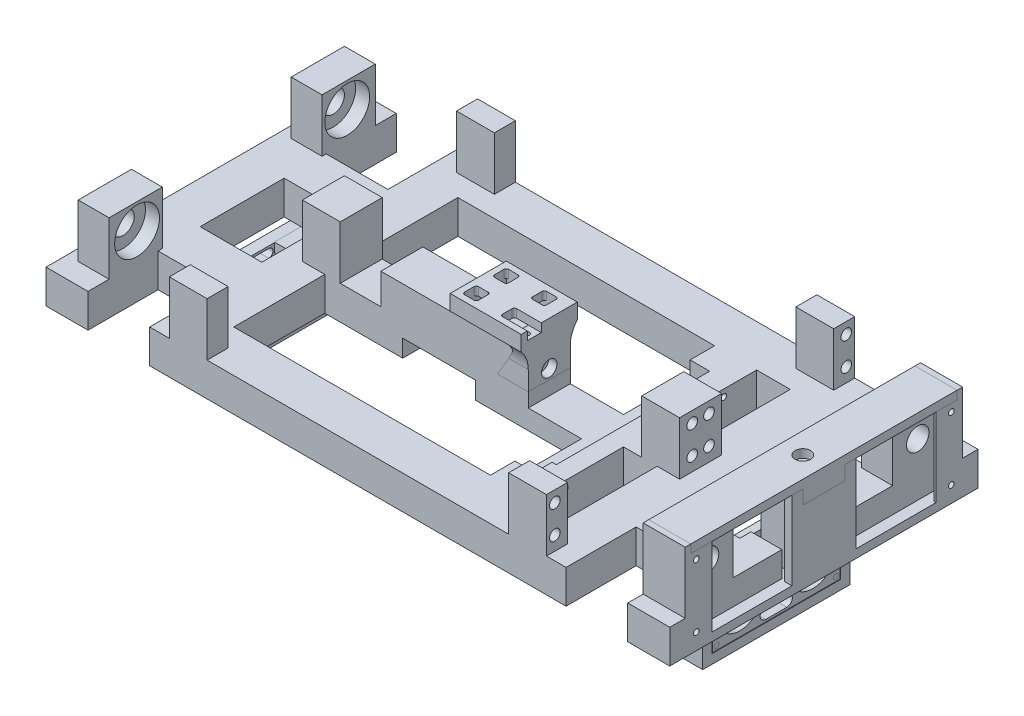
from build123d import *

# Parameters (mm, degrees)
SKETCH1_W               = 118.6
SKETCH1_H               = 32.5
BOSS_EXTRUDE1_DEPTH     = 12
SKETCH2_W               = 12
SKETCH2_H               = 7.5
BOSS_EXTRUDE2_DEPTH     = 19
SKETCH3_R               = 1.9
CUT_EXTRUDE1_DEPTH      = 190.430620545
SKETCH4_W               = 19
SKETCH4_H               = 19
SKETCH4_R               = 8
BOSS_EXTRUDE3_DEPTH     = 5
BOSS_EXTRUDE3_2_DEPTH   = 5
SKETCH6_W               = 19
SKETCH6_H               = 19
SKETCH6_R               = 4
BOSS_EXTRUDE4_DEPTH     = 6
SKETCH7_W               = 22
SKETCH7_H               = 15
BOSS_EXTRUDE5_DEPTH     = 12
SKETCH8_W               = 22
SKETCH8_H               = 30
CUT_EXTRUDE2_DEPTH      = 126.593351735
SKETCH9_W               = 40
SKETCH9_H               = 28
CUT_EXTRUDE3_DEPTH      = 4
CUT_EXTRUDE5_REACH      = 229.535
SKETCH11_W              = 3.5
SKETCH11_H              = 9
BOSS_EXTRUDE6_REACH     = 129.266
CUT_EXTRUDE7_DEPTH      = 228.534524853
CUT_EXTRUDE7_DEPTH_BACK = 3
SKETCH10_R              = 1
SKETCH13_W              = 15
SKETCH13_H              = 15
BOSS_EXTRUDE7_DEPTH     = 14
SKETCH14_W              = 15
SKETCH14_H              = 32.5
BOSS_EXTRUDE8_DEPTH     = 12
SKETCH16_W              = 15
SKETCH16_H              = 32.5
CUT_EXTRUDE8_DEPTH      = 126.593351735
SKETCH17_W              = 15
SKETCH17_H              = 32.5
BOSS_EXTRUDE9_DEPTH     = 12
SKETCH15_W              = 26
SKETCH15_H              = 62.5
CUT_EXTRUDE9_DEPTH      = 5
CUT_EXTRUDE10_REACH     = 165.298
SKETCH18_R              = 1
SKETCH19_W              = 50
SKETCH19_H              = 7
CUT_EXTRUDE11_DEPTH     = 1.5
BOSS_EXTRUDE10_DEPTH    = 15
BOSS_EXTRUDE11_DEPTH    = 15
BOSS_EXTRUDE12_DEPTH    = 4.6
BOSS_EXTRUDE13_DEPTH    = 18.6
SKETCH29_W              = 20
SKETCH29_H              = 5.5
BOSS_EXTRUDE14_DEPTH    = 2.15
SKETCH31_W              = 4.6
SKETCH31_H              = 5
SKETCH31_W_2            = 0.8
CUT_EXTRUDE12_DEPTH     = 128.266217041
FILLET1_R               = 10
SKETCH32_R              = 2.75
CUT_EXTRUDE13_DEPTH     = 3
SKETCH33_R              = 1.425
CUT_EXTRUDE14_DEPTH     = 20
SKETCH34_R              = 1
CUT_EXTRUDE15_DEPTH     = 128.266217041
BOSS_EXTRUDE15_DEPTH    = 5
BOSS_EXTRUDE16_DEPTH    = 3
SKETCH37_R              = 2.75
CUT_EXTRUDE16_DEPTH     = 3
SKETCH38_R              = 1.4
CUT_EXTRUDE17_DEPTH     = 20
SKETCH39_R              = 1.5
CUT_EXTRUDE18_DEPTH     = 3.5
SKETCH39_2_R            = 1.5
BOSS_EXTRUDE17_DEPTH    = 3.5
SKETCH41_W              = 3
SKETCH41_H              = 3.5
SKETCH41_H_2            = 7.75
SKETCH41_H_3            = 30
BOSS_EXTRUDE18_DEPTH    = 24
BOSS_EXTRUDE19_DEPTH    = 9
SKETCH43_R              = 0.9
CUT_EXTRUDE19_DEPTH     = 2
SKETCH44_W              = 7.5
SKETCH44_H              = 5
BOSS_EXTRUDE20_DEPTH    = 7.5
SKETCH45_R              = 2.75
CUT_EXTRUDE20_DEPTH     = 3
SKETCH47_R              = 1.4
CUT_EXTRUDE22_DEPTH     = 10
BOSS_EXTRUDE22_START    = 5
SKETCH48_W              = 45.5
SKETCH48_H              = 20.3
SKETCH48_R              = 8.1
SKETCH48_R_2            = 0.9
BOSS_EXTRUDE22_DEPTH    = 4
SKETCH49_R              = 0.9
BOSS_EXTRUDE23_DEPTH    = 11
BOSS_EXTRUDE23_2_DEPTH  = 11
BOSS_EXTRUDE23_3_DEPTH  = 11
BOSS_EXTRUDE23_4_DEPTH  = 11
SKETCH42_3_W            = 14.45
SKETCH42_3_H            = 3.3
BOSS_EXTRUDE24_DEPTH    = 5
SKETCH50_W              = 26
SKETCH50_H              = 2.2
SKETCH50_H_2            = 12.8
CUT_EXTRUDE23_DEPTH     = 5
SKETCH50_4_W            = 26
SKETCH50_4_H            = 2.2
CUT_EXTRUDE25_DEPTH     = 6.2
SKETCH52_W              = 14.45
SKETCH52_H              = 3.3
BOSS_EXTRUDE25_DEPTH    = 5
SKETCH53_R              = 1.4
CUT_EXTRUDE26_DEPTH     = 8.6
SKETCH54_W              = 15
SKETCH54_H              = 2
BOSS_EXTRUDE26_DEPTH    = 22
SKETCH55_W              = 1.5
SKETCH55_H              = 7.5
SKETCH55_H_2            = 15
BOSS_EXTRUDE27_DEPTH    = 19


with BuildPart() as part:
    # Sketch1 → Boss-Extrude1 (new body)
    with BuildSketch(Plane(origin=(0, 0, 0), x_dir=(1, 0, 0), z_dir=(0, 1, 0))):
        Polygon((-96.3, -55), (-96.3, -7.5), (-74.3, -7.5), (-74.3, -55), (74.3, -55), (74.3, -7.5), (96.3, -7.5), (96.3, -55), (111.3, -55), (111.3, 55), (96.3, 55), (96.3, 7.5), (74.3, 7.5), (74.3, 55), (-74.3, 55), (-74.3, 7.5), (-96.3, 7.5), (-96.3, 55), (-111.3, 55), (-111.3, -55), align=None)
        with Locations((0, -23.75)):
            Rectangle(SKETCH1_W, SKETCH1_H, mode=Mode.SUBTRACT)
        with Locations((0, 23.75)):
            Rectangle(SKETCH1_W, SKETCH1_H, mode=Mode.SUBTRACT)
    extrude(amount=BOSS_EXTRUDE1_DEPTH)

    # Sketch2 → Boss-Extrude2 (add)
    with BuildSketch(Plane(origin=(0, 12, 0), x_dir=(1, 0, 0), z_dir=(0, 1, 0))):
        with Locations((-61.3, 51.25)):
            Rectangle(SKETCH2_W, SKETCH2_H)
        Polygon((-67.3, 7.5), (-55.3, 7.5), (-55.3, 0), (-55.3, -7.5), (-67.3, -7.5), (-67.3, 0), align=None)
        with Locations((-61.3, -51.25)):
            Rectangle(SKETCH2_W, SKETCH2_H)
        with Locations((61.3, -51.25)):
            Rectangle(SKETCH2_W, SKETCH2_H)
        Polygon((67.3, 7.5), (67.3, 0), (67.3, -7.5), (55.3, -7.5), (55.3, 0), (55.3, 7.5), align=None)
        with Locations((61.3, 51.25)):
            Rectangle(SKETCH2_W, SKETCH2_H)
    extrude(amount=BOSS_EXTRUDE2_DEPTH)

    # Sketch3 → Cut-Extrude1 (cut, through all)
    with BuildSketch(Plane.ZY.offset(67.3)):
        with Locations((-52, 17)):
            Circle(SKETCH3_R)
        with Locations((-52, 27)):
            Circle(SKETCH3_R)
        with Locations((-3, 17)):
            Circle(SKETCH3_R)
        with Locations((-3, 27)):
            Circle(SKETCH3_R)
        with Locations((3, 27)):
            Circle(SKETCH3_R)
        with Locations((3, 17)):
            Circle(SKETCH3_R)
        with Locations((52, 17)):
            Circle(SKETCH3_R)
        with Locations((52, 27)):
            Circle(SKETCH3_R)
    extrude(amount=-CUT_EXTRUDE1_DEPTH, mode=Mode.SUBTRACT)



with BuildPart() as body_2:
    # Sketch4 → Boss-Extrude3 (new body)
    with BuildSketch(Plane.ZY.offset(-96.3)):
        with Locations((-38, 21.5)):
            Rectangle(SKETCH4_W, SKETCH4_H)
        with Locations(Location((-37.5, 22, 0), (0, 0, 180))):
            Circle(SKETCH4_R, mode=Mode.SUBTRACT)
    extrude(amount=-BOSS_EXTRUDE3_DEPTH)


with BuildPart() as body_3:
    # Sketch4 → Boss-Extrude3 2 (new body)
    with BuildSketch(Plane.ZY.offset(-96.3)):
        with Locations((38, 21.5)):
            Rectangle(SKETCH4_W, SKETCH4_H)
        with Locations((37.5, 22)):
            Circle(SKETCH4_R, mode=Mode.SUBTRACT)
    extrude(amount=-BOSS_EXTRUDE3_2_DEPTH)


    add(body_2.part)  # Boss-Extrude4 merges body 2
    # Sketch6 → Boss-Extrude4 (add)
    # profile 1 of 2: a face of its own
    with BuildSketch(Plane(origin=(101.3, 0, 0), x_dir=(0, 0, -1), z_dir=(1, 0, 0))):
        with Locations((-38, 21.5)):
            Rectangle(SKETCH6_W, SKETCH6_H)
        with Locations((-37.5, 22)):
            Circle(SKETCH6_R, mode=Mode.SUBTRACT)
    # profile 2 of 2: a face of its own
    with BuildSketch(Plane(origin=(101.3, 0, 0), x_dir=(0, 0, -1), z_dir=(1, 0, 0))):
        with Locations((38, 21.5)):
            Rectangle(SKETCH6_W, SKETCH6_H)
        with Locations((37.5, 22)):
            Circle(SKETCH6_R, mode=Mode.SUBTRACT)
    extrude(amount=BOSS_EXTRUDE4_DEPTH)


with BuildPart() as body_3_2:
    # Mirror1: mirrored copy
    add(body_3.part.mirror(Plane(origin=(0, 0, 0), x_dir=(0, 0, 1), z_dir=(1, 0, 0))))


with BuildPart() as part_1:
    add(part.part)

    add(body_3.part)  # Boss-Extrude5 merges body 3

    add(body_3_2.part)  # Boss-Extrude5 merges body 3 2
    # Sketch7 → Boss-Extrude5 (add)
    with BuildSketch(Plane(origin=(0, 0, 0), x_dir=(1, 0, 0), z_dir=(0, 1, 0))):
        with Locations((-85.3, 22.5)):
            Rectangle(SKETCH7_W, SKETCH7_H)
        with Locations((85.3, 22.5)):
            Rectangle(SKETCH7_W, SKETCH7_H)
        with Locations((85.3, -22.5)):
            Rectangle(SKETCH7_W, SKETCH7_H)
        with Locations((-85.3, -22.5)):
            Rectangle(SKETCH7_W, SKETCH7_H)
    extrude(amount=BOSS_EXTRUDE5_DEPTH)

    # Sketch8 → Cut-Extrude2 (cut, through all)
    with BuildSketch(Plane(origin=(0, 12, 0), x_dir=(1, 0, 0), z_dir=(0, 1, 0))):
        with Locations((-85.3, 0)):
            Rectangle(SKETCH8_W, SKETCH8_H)
        with Locations((85.3, 0)):
            Rectangle(SKETCH8_W, SKETCH8_H)
    extrude(amount=-CUT_EXTRUDE2_DEPTH, mode=Mode.SUBTRACT)

    # Sketch9 → Cut-Extrude3 (cut)
    with BuildSketch(Plane(origin=(111.3, 0, 0), x_dir=(0, 0, -1), z_dir=(1, 0, 0))):
        with Locations((-27.5, 17)):
            Rectangle(SKETCH9_W, SKETCH9_H)
        with Locations((27.5, 17)):
            Rectangle(SKETCH9_W, SKETCH9_H)
    extrude(amount=-CUT_EXTRUDE3_DEPTH, mode=Mode.SUBTRACT)

    # Sketch11 → Cut-Extrude5 (cut, up to next)
    with BuildSketch(Plane(origin=(107.3, 0, 0), x_dir=(0, 0, -1), z_dir=(1, 0, 0)), mode=Mode.PRIVATE) as cut_extrude5_sk1:
        with Locations((-9.25, 7.5)):
            Rectangle(SKETCH11_W, SKETCH11_H)
    cut_extrude5_tool1 = extrude(cut_extrude5_sk1.sketch, amount=-CUT_EXTRUDE5_REACH, mode=Mode.PRIVATE) & part_1.part
    # Sketch11 → Cut-Extrude5 (cut, up to next)
    with BuildSketch(Plane(origin=(107.3, 0, 0), x_dir=(0, 0, -1), z_dir=(1, 0, 0)), mode=Mode.PRIVATE) as cut_extrude5_sk2:
        with Locations((9.25, 7.5)):
            Rectangle(SKETCH11_W, SKETCH11_H)
    cut_extrude5_tool2 = extrude(cut_extrude5_sk2.sketch, amount=-CUT_EXTRUDE5_REACH, mode=Mode.PRIVATE) & part_1.part
    add(cut_extrude5_tool1.solids().sort_by_distance((107.3, 7.5, 9.25))[0], mode=Mode.SUBTRACT)
    add(cut_extrude5_tool2.solids().sort_by_distance((107.3, 7.5, -9.25))[0], mode=Mode.SUBTRACT)

    # Boss-Extrude6: up to this face of the body (flat: up to its plane)
    boss_extrude6_end = Plane(part_1.part.faces().sort_by_distance((101.8, 31, 38))[0])
    # Sketch12 → Boss-Extrude6 (add, up to the picked face)
    with BuildSketch(Plane(origin=(0, 3, 0), x_dir=(1, 0, 0), z_dir=(0, 1, 0)), mode=Mode.PRIVATE) as boss_extrude6_sk1:
        Polygon((108.6, -11.4), (111.3, -11.4), (111.3, -7.5), (110.6, -7.5), (110.6, -10.4), (108.6, -10.4), align=None)
    boss_extrude6_tool1 = split(extrude(boss_extrude6_sk1.sketch, amount=BOSS_EXTRUDE6_REACH, mode=Mode.PRIVATE), bisect_by=boss_extrude6_end, keep=Keep.BOTH, mode=Mode.PRIVATE)
    # Sketch12 → Boss-Extrude6 (add, up to the picked face)
    with BuildSketch(Plane(origin=(0, 3, 0), x_dir=(1, 0, 0), z_dir=(0, 1, 0)), mode=Mode.PRIVATE) as boss_extrude6_sk2:
        Polygon((111.3, -47.5), (108.6, -47.5), (108.6, -42.5), (110.6, -42.5), (110.6, -40), (111.3, -40), (111.3, -42.5), align=None)
    boss_extrude6_tool2 = split(extrude(boss_extrude6_sk2.sketch, amount=BOSS_EXTRUDE6_REACH, mode=Mode.PRIVATE), bisect_by=boss_extrude6_end, keep=Keep.BOTH, mode=Mode.PRIVATE)
    # Sketch12 → Boss-Extrude6 (add, up to the picked face)
    with BuildSketch(Plane(origin=(0, 3, 0), x_dir=(1, 0, 0), z_dir=(0, 1, 0)), mode=Mode.PRIVATE) as boss_extrude6_sk3:
        Polygon((111.3, 47.5), (108.6, 47.5), (108.6, 42.5), (110.6, 42.5), (110.6, 40), (111.3, 40), (111.3, 42.5), align=None)
    boss_extrude6_tool3 = split(extrude(boss_extrude6_sk3.sketch, amount=BOSS_EXTRUDE6_REACH, mode=Mode.PRIVATE), bisect_by=boss_extrude6_end, keep=Keep.BOTH, mode=Mode.PRIVATE)
    # Sketch12 → Boss-Extrude6 (add, up to the picked face)
    with BuildSketch(Plane(origin=(0, 3, 0), x_dir=(1, 0, 0), z_dir=(0, 1, 0)), mode=Mode.PRIVATE) as boss_extrude6_sk4:
        Polygon((108.6, 11.4), (108.6, 10.4), (110.6, 10.4), (110.6, 7.5), (111.3, 7.5), (111.3, 11.4), align=None)
    boss_extrude6_tool4 = split(extrude(boss_extrude6_sk4.sketch, amount=BOSS_EXTRUDE6_REACH, mode=Mode.PRIVATE), bisect_by=boss_extrude6_end, keep=Keep.BOTH, mode=Mode.PRIVATE)
    add(boss_extrude6_tool1.solids().sort_by(Axis((109.95, 3, 11.352566), (0, 1, 0)))[0])
    add(boss_extrude6_tool2.solids().sort_by(Axis((110.064754, 3, 44.569672), (0, 1, 0)))[0])
    add(boss_extrude6_tool3.solids().sort_by(Axis((110.064754, 3, -44.569672), (0, 1, 0)))[0])
    add(boss_extrude6_tool4.solids().sort_by(Axis((108.647434, 3, -10.9), (0, 1, 0)))[0])

    # Sketch10 → Cut-Extrude7 (cut, two sides: drawn at the far end of the back side and taken through both)
    with BuildSketch(Plane(origin=(107.3, 0, 0), x_dir=(0, 0, -1), z_dir=(1, 0, 0)).offset(-CUT_EXTRUDE7_DEPTH_BACK)):
        with Locations((-45.5, 28.25)):
            Circle(SKETCH10_R)
        with Locations((-45.5, 5.75)):
            Circle(SKETCH10_R)
        with Locations(Location((45.5, 5.75, 0), (0, 0, 180))):
            Circle(SKETCH10_R)
        with Locations(Location((45.5, 28.25, 0), (0, 0, 180))):
            Circle(SKETCH10_R)
    extrude(amount=CUT_EXTRUDE7_DEPTH + CUT_EXTRUDE7_DEPTH_BACK, mode=Mode.SUBTRACT)

    # Sketch13 → Boss-Extrude7 (add)
    with BuildSketch(Plane(origin=(0, 12, 0), x_dir=(1, 0, 0), z_dir=(0, 1, 0))):
        with Locations((103.8, 0)):
            Rectangle(SKETCH13_W, SKETCH13_H)
    extrude(amount=BOSS_EXTRUDE7_DEPTH)

    # Sketch14 → Boss-Extrude8 (add)
    with BuildSketch(Plane(origin=(0, 0, 0), x_dir=(1, 0, 0), z_dir=(0, 1, 0))):
        with Locations((0, -23.75)):
            Rectangle(SKETCH14_W, SKETCH14_H)
        with Locations((0, 23.75)):
            Rectangle(SKETCH14_W, SKETCH14_H)
    extrude(amount=BOSS_EXTRUDE8_DEPTH)

    # Sketch16 → Cut-Extrude8 (cut, through all)
    with BuildSketch(Plane(origin=(0, 12, 0), x_dir=(1, 0, 0), z_dir=(0, 1, 0))):
        with Locations((0, 23.75)):
            Rectangle(SKETCH16_W, SKETCH16_H)
        with Locations((0, -23.75)):
            Rectangle(SKETCH16_W, SKETCH16_H)
    extrude(amount=-CUT_EXTRUDE8_DEPTH, mode=Mode.SUBTRACT)

    # Sketch17 → Boss-Extrude9 (add)
    with BuildSketch(Plane(origin=(0, 0, 0), x_dir=(1, 0, 0), z_dir=(0, 1, 0))):
        with Locations((39.800000001, 23.75)):
            Rectangle(SKETCH17_W, SKETCH17_H)
        with Locations((39.800000001, -23.75)):
            Rectangle(SKETCH17_W, SKETCH17_H)
    extrude(amount=BOSS_EXTRUDE9_DEPTH)

    # Sketch15 → Cut-Extrude9 (cut)
    with BuildSketch(Plane(origin=(0, 12, 0), x_dir=(1, 0, 0), z_dir=(0, 1, 0))):
        with Locations((26.3, 0)):
            Rectangle(SKETCH15_W, SKETCH15_H)
    extrude(amount=-CUT_EXTRUDE9_DEPTH, mode=Mode.SUBTRACT)

    # Sketch18 → Cut-Extrude10 (cut, up to next)
    with BuildSketch(Plane.ZY.offset(-39.3), mode=Mode.PRIVATE) as cut_extrude10_sk1:
        with Locations((28.25, 9.5)):
            Circle(SKETCH18_R)
    cut_extrude10_tool1 = extrude(cut_extrude10_sk1.sketch, amount=-CUT_EXTRUDE10_REACH, mode=Mode.PRIVATE) & part_1.part
    # Sketch18 → Cut-Extrude10 (cut, up to next)
    with BuildSketch(Plane.ZY.offset(-39.3), mode=Mode.PRIVATE) as cut_extrude10_sk2:
        with Locations((-28.25, 9.5)):
            Circle(SKETCH18_R)
    cut_extrude10_tool2 = extrude(cut_extrude10_sk2.sketch, amount=-CUT_EXTRUDE10_REACH, mode=Mode.PRIVATE) & part_1.part
    add(cut_extrude10_tool1.solids().sort_by_distance((39.3, 9.5, 28.25))[0], mode=Mode.SUBTRACT)
    add(cut_extrude10_tool2.solids().sort_by_distance((39.3, 9.5, -28.25))[0], mode=Mode.SUBTRACT)

    # Sketch19 → Cut-Extrude11 (cut)
    with BuildSketch(Plane.ZY.offset(-39.3)):
        with Locations((0, 10.5)):
            Rectangle(SKETCH19_W, SKETCH19_H)
    extrude(amount=-CUT_EXTRUDE11_DEPTH, mode=Mode.SUBTRACT)

    # Sketch21 → Boss-Extrude10 (add)
    with BuildSketch(Plane.XY.offset(7.5)):
        Polygon((-39.3, 12), (2.349147039, 12), (8.7, 23), (-39.3, 23), align=None)
    extrude(amount=-BOSS_EXTRUDE10_DEPTH)


with BuildPart() as body_2_2:
    # Sketch22 → Boss-Extrude11 (new body)
    with BuildSketch(Plane.XY.offset(7.5)):
        Polygon((2.349147039, 12), (13.3, 12), (13.3, 23), (8.7, 23), align=None)
    extrude(amount=-BOSS_EXTRUDE11_DEPTH)

    # Sketch25 → Boss-Extrude12 (add)
    with BuildSketch(Plane(origin=(13.3, 0, 0), x_dir=(0, 0, -1), z_dir=(1, 0, 0))):
        Polygon((-7.5, 23), (7.5, 23), (10, 25.5), (10, 31), (-10, 31), (-10, 25.5), align=None)
    extrude(amount=-BOSS_EXTRUDE12_DEPTH)

    # Sketch28 → Boss-Extrude13 (add)
    with BuildSketch(Plane.ZY.offset(-8.7)):
        Polygon((-10, 31), (10, 31), (10, 25.5), (7.85, 25.5), (7.85, 28), (-7.85, 28), (-7.85, 25.5), (-10, 25.5), align=None)
    extrude(amount=BOSS_EXTRUDE13_DEPTH)

    # Sketch29 → Boss-Extrude14 (add)
    with BuildSketch(Plane.ZY.offset(9.9)):
        with Locations((0, 28.25)):
            Rectangle(SKETCH29_W, SKETCH29_H)
    extrude(amount=BOSS_EXTRUDE14_DEPTH)

    # Sketch31 → Cut-Extrude12 (cut, through all)
    with BuildSketch(Plane.XZ.offset(-28)):
        with BuildLine():
            ThreePointArc((-4.9, 7.05), (-5.134314575, 7.615685425), (-5.7, 7.85))
            Line((-5.7, 7.85), (-9.1, 7.85))
            ThreePointArc((-9.1, 7.85), (-9.665685425, 7.615685425), (-9.9, 7.05))
            Line((-9.9, 7.05), (-9.9, 3.65))
            ThreePointArc((-9.9, 3.65), (-9.665685425, 3.084314575), (-9.1, 2.85))
            Line((-9.1, 2.85), (-5.7, 2.85))
            ThreePointArc((-5.7, 2.85), (-5.134314575, 3.084314575), (-4.9, 3.65))
            Line((-4.9, 3.65), (-4.9, 7.05))
        make_face()
        with BuildLine():
            ThreePointArc((-9.1, -2.85), (-9.665685425, -3.084314575), (-9.9, -3.65))
            Line((-9.9, -3.65), (-9.9, -7.05))
            ThreePointArc((-9.9, -7.05), (-9.665685425, -7.615685425), (-9.1, -7.85))
            Line((-9.1, -7.85), (-5.7, -7.85))
            ThreePointArc((-5.7, -7.85), (-5.134314575, -7.615685425), (-4.9, -7.05))
            Line((-4.9, -7.05), (-4.9, -3.65))
            ThreePointArc((-4.9, -3.65), (-5.134314575, -3.084314575), (-5.7, -2.85))
            Line((-5.7, -2.85), (-9.1, -2.85))
        make_face()
        with BuildLine():
            Line((8.7, -7.05), (8.7, -3.65))
            ThreePointArc((8.7, -3.65), (8.465685425, -3.084314575), (7.9, -2.85))
            Line((7.9, -2.85), (4.5, -2.85))
            ThreePointArc((4.5, -2.85), (3.934314575, -3.084314575), (3.7, -3.65))
            Line((3.7, -3.65), (3.7, -7.05))
            ThreePointArc((3.7, -7.05), (3.934314575, -7.615685425), (4.5, -7.85))
            Line((4.5, -7.85), (7.9, -7.85))
            ThreePointArc((7.9, -7.85), (8.465685425, -7.615685425), (8.7, -7.05))
        make_face()
        with BuildLine():
            Line((7.9, 2.85), (7.9, 7.85))
            Line((7.9, 7.85), (4.5, 7.85))
            ThreePointArc((4.5, 7.85), (3.934314575, 7.615685425), (3.7, 7.05))
            Line((3.7, 7.05), (3.7, 3.65))
            ThreePointArc((3.7, 3.65), (3.934314575, 3.084314575), (4.5, 2.85))
            Line((4.5, 2.85), (7.9, 2.85))
        make_face()
        with Locations((11, 5.35)):
            Rectangle(SKETCH31_W, SKETCH31_H)
        with Locations((8.3, 5.35)):
            Rectangle(SKETCH31_W_2, SKETCH31_H)
    extrude(amount=-CUT_EXTRUDE12_DEPTH, mode=Mode.SUBTRACT)

    # Fillet1
    # the kernel refuses this fillet: 10 mm, written as the material it adds along each edge
    with BuildSketch(Plane(origin=(13.3, 23, -7.5), x_dir=(0, -1, 0), z_dir=(-1, 0, 0))) as fillet1_piece_1_section:
        with BuildLine():
            CenterArc((4.114378278, -10), FILLET1_R, 90, 41.409622109)
            Line((-2.5, -2.5), (-2.632287566, -2.35))
            ThreePointArc((-2.632287566, -2.35), (-1.391421356, -1.108578644), (-0.141421356, 0.141421356))
            Line((-0.141421356, 0.141421356), (0, 0.2))
            Line((0, 0.2), (4.114378278, 0.2))
            Line((4.114378278, 0.2), (4.114378278, 0))
        make_face()
    fillet1_piece_1 = extrude(amount=4.6, mode=Mode.PRIVATE)
    fillet1_piece_1 = split(fillet1_piece_1, bisect_by=Plane(origin=(9.096153746, 23.686158416, -7.983284624), z_dir=(0.8660254037844364, -0.5000000000000041, 0)), keep=Keep.TOP, mode=Mode.PRIVATE)
    add(fillet1_piece_1)
    with BuildSketch(Plane(origin=(13.3, 23, -7.5), x_dir=(0, -1, 0), z_dir=(-1, 0, 0))) as fillet1_piece_2_section:
        with BuildLine():
            CenterArc((4.114378278, -10), FILLET1_R, 90, 41.409622109)
            Line((-2.5, -2.5), (-2.632287566, -2.35))
            ThreePointArc((-2.632287566, -2.35), (-1.391421356, -1.108578644), (-0.141421356, 0.141421356))
            Line((-0.141421356, 0.141421356), (0, 0.2))
            Line((0, 0.2), (4.114378278, 0.2))
            Line((4.114378278, 0.2), (4.114378278, 0))
        make_face()
    fillet1_piece_2 = extrude(amount=4.6, mode=Mode.PRIVATE)
    fillet1_piece_2 = split(fillet1_piece_2, bisect_by=Plane(origin=(9.445149501, 24.290636794, -8.967207372), z_dir=(-0.8660254037844364, 0.5000000000000041, 0)), keep=Keep.TOP, mode=Mode.PRIVATE)
    add(fillet1_piece_2)
    with BuildSketch(Plane(origin=(13.3, 23, -7.5), x_dir=(0, -1, 0), z_dir=(-1, 0, 0))) as fillet1_piece_3_section:
        with BuildLine():
            CenterArc((4.114378278, -10), FILLET1_R, 90, 41.409622109)
            Line((-2.5, -2.5), (-2.632287566, -2.35))
            ThreePointArc((-2.632287566, -2.35), (-1.391421356, -1.108578644), (-0.141421356, 0.141421356))
            Line((-0.141421356, 0.141421356), (0, 0.2))
            Line((0, 0.2), (4.114378278, 0.2))
            Line((4.114378278, 0.2), (4.114378278, 0))
        make_face()
    fillet1_piece_3 = extrude(amount=14.885945694, mode=Mode.PRIVATE)
    fillet1_piece_3 = split(fillet1_piece_3, bisect_by=Plane(origin=(7.54772373, 21.004198955, -7.51467089), z_dir=(0.8660254037844364, -0.5000000000000041, 0)), keep=Keep.TOP, mode=Mode.PRIVATE)
    fillet1_piece_3 = split(fillet1_piece_3, bisect_by=Plane(origin=(8.7, 20.719084521, -7.51467089), z_dir=(-1, 0, 0)), keep=Keep.TOP, mode=Mode.PRIVATE)
    add(fillet1_piece_3)
    with BuildSketch(Plane(origin=(13.3, 23, 7.5), x_dir=(0, -1, 0), z_dir=(-1, 0, 0))) as fillet1_piece_4_section:
        with BuildLine():
            CenterArc((4.114378278, 10), FILLET1_R, 228.590377891, 41.409622109)
            Line((-2.5, 2.5), (-2.632287566, 2.35))
            ThreePointArc((-2.632287566, 2.35), (-1.391421356, 1.108578644), (-0.141421356, -0.141421356))
            Line((-0.141421356, -0.141421356), (0, -0.2))
            Line((0, -0.2), (4.114378278, -0.2))
            Line((4.114378278, -0.2), (4.114378278, 0))
        make_face()
    fillet1_piece_4 = extrude(amount=4.6, mode=Mode.PRIVATE)
    fillet1_piece_4 = split(fillet1_piece_4, bisect_by=Plane(origin=(9.096153746, 23.686158416, 7.983284624), z_dir=(0.8660254037844364, -0.5000000000000041, 0)), keep=Keep.TOP, mode=Mode.PRIVATE)
    add(fillet1_piece_4)
    with BuildSketch(Plane(origin=(13.3, 23, 7.5), x_dir=(0, -1, 0), z_dir=(-1, 0, 0))) as fillet1_piece_5_section:
        with BuildLine():
            CenterArc((4.114378278, 10), FILLET1_R, 228.590377891, 41.409622109)
            Line((-2.5, 2.5), (-2.632287566, 2.35))
            ThreePointArc((-2.632287566, 2.35), (-1.391421356, 1.108578644), (-0.141421356, -0.141421356))
            Line((-0.141421356, -0.141421356), (0, -0.2))
            Line((0, -0.2), (4.114378278, -0.2))
            Line((4.114378278, -0.2), (4.114378278, 0))
        make_face()
    fillet1_piece_5 = extrude(amount=4.6, mode=Mode.PRIVATE)
    fillet1_piece_5 = split(fillet1_piece_5, bisect_by=Plane(origin=(9.445149501, 24.290636794, 8.967207372), z_dir=(-0.8660254037844364, 0.5000000000000041, 0)), keep=Keep.TOP, mode=Mode.PRIVATE)
    add(fillet1_piece_5)
    with BuildSketch(Plane(origin=(13.3, 23, 7.5), x_dir=(0, -1, 0), z_dir=(-1, 0, 0))) as fillet1_piece_6_section:
        with BuildLine():
            CenterArc((4.114378278, 10), FILLET1_R, 228.590377891, 41.409622109)
            Line((-2.5, 2.5), (-2.632287566, 2.35))
            ThreePointArc((-2.632287566, 2.35), (-1.391421356, 1.108578644), (-0.141421356, -0.141421356))
            Line((-0.141421356, -0.141421356), (0, -0.2))
            Line((0, -0.2), (4.114378278, -0.2))
            Line((4.114378278, -0.2), (4.114378278, 0))
        make_face()
    fillet1_piece_6 = extrude(amount=14.885945694, mode=Mode.PRIVATE)
    fillet1_piece_6 = split(fillet1_piece_6, bisect_by=Plane(origin=(7.54772373, 21.004198955, 7.51467089), z_dir=(0.8660254037844364, -0.5000000000000041, 0)), keep=Keep.TOP, mode=Mode.PRIVATE)
    fillet1_piece_6 = split(fillet1_piece_6, bisect_by=Plane(origin=(8.7, 20.719084521, 7.51467089), z_dir=(-1, 0, 0)), keep=Keep.TOP, mode=Mode.PRIVATE)
    add(fillet1_piece_6)

    # Sketch32 → Cut-Extrude13 (cut)
    with BuildSketch(Plane(origin=(13.3, 0, 0), x_dir=(0, 0, -1), z_dir=(1, 0, 0))):
        with Locations((0, 15.5)):
            Circle(SKETCH32_R)
    extrude(amount=-CUT_EXTRUDE13_DEPTH, mode=Mode.SUBTRACT)


with BuildPart() as cut_extrude14_tool:
    # Sketch33 → Cut-Extrude14 (new body)
    with BuildSketch(Plane(origin=(10.3, 0, 0), x_dir=(0, 0, -1), z_dir=(1, 0, 0))):
        with Locations((0, 15.5)):
            Circle(SKETCH33_R)
    extrude(amount=-CUT_EXTRUDE14_DEPTH)


with BuildPart() as part_2:
    add(part_1.part)

    # Cut-Extrude14: cut by cut_extrude14_tool
    add(cut_extrude14_tool.part, mode=Mode.SUBTRACT)


with BuildPart() as body_2_2_1:
    add(body_2_2.part)

    # Cut-Extrude14: cut by cut_extrude14_tool
    add(cut_extrude14_tool.part, mode=Mode.SUBTRACT)


with BuildPart() as cut_extrude15_tool:
    # Sketch34 → Cut-Extrude15 (new, through all)
    with BuildSketch(Plane(origin=(0, 28, 0), x_dir=(1, 0, 0), z_dir=(0, 1, 0))):
        with Locations(Location((11, -5.85, 0), (0, 0, 270))):
            Circle(SKETCH34_R)
    extrude(amount=-CUT_EXTRUDE15_DEPTH)


with BuildPart() as part_3:
    add(part_2.part)

    # Cut-Extrude15: cut by cut_extrude15_tool
    add(cut_extrude15_tool.part, mode=Mode.SUBTRACT)


with BuildPart() as body_2_2_2:
    add(body_2_2_1.part)

    # Cut-Extrude15: cut by cut_extrude15_tool
    add(cut_extrude15_tool.part, mode=Mode.SUBTRACT)


with BuildPart() as body_3_3:
    # Sketch35 → Boss-Extrude15 (new body)
    with BuildSketch(Plane(origin=(0, 26, 0), x_dir=(1, 0, 0), z_dir=(0, 1, 0))):
        Polygon((111.3, -7.5), (111.3, 7.5), (110.6, 7.5), (96.3, 7.5), (96.3, -7.5), (110.6, -7.5), align=None)
    extrude(amount=BOSS_EXTRUDE15_DEPTH)

    # Sketch36 → Boss-Extrude16 (add)
    with BuildSketch(Plane(origin=(0, 31, 0), x_dir=(1, 0, 0), z_dir=(0, 1, 0))):
        Polygon((96.3, 7.5), (96.3, 47.5), (111.3, 47.5), (111.3, 7.5), (111.3, -7.5), (111.3, -47.5), (96.3, -47.5), (96.3, -7.5), align=None)
    extrude(amount=BOSS_EXTRUDE16_DEPTH)

    # Sketch37 → Cut-Extrude16 (cut)
    with BuildSketch(Plane(origin=(0, 34, 0), x_dir=(1, 0, 0), z_dir=(0, 1, 0))):
        with Locations(Location((103.8, 0, 0), (0, 0, 270))):
            Circle(SKETCH37_R)
    extrude(amount=-CUT_EXTRUDE16_DEPTH, mode=Mode.SUBTRACT)


with BuildPart() as cut_extrude17_tool:
    # Sketch38 → Cut-Extrude17 (new body)
    with BuildSketch(Plane(origin=(0, 31, 0), x_dir=(1, 0, 0), z_dir=(0, 1, 0))):
        with Locations(Location((103.8, 0, 0), (0, 0, 270))):
            Circle(SKETCH38_R)
    extrude(amount=-CUT_EXTRUDE17_DEPTH)


with BuildPart() as part_4:
    add(part_3.part)

    # Cut-Extrude17: cut by cut_extrude17_tool
    add(cut_extrude17_tool.part, mode=Mode.SUBTRACT)

    # Sketch39 → Cut-Extrude18 (cut)
    with BuildSketch(Plane(origin=(0, 31, 0), x_dir=(1, 0, 0), z_dir=(0, 1, 0))):
        with Locations(Location((101.8, -45.5, 0), (0, 0, 270))):
            Circle(SKETCH39_R)
        with Locations(Location((101.8, 45.5, 0), (0, 0, 90))):
            Circle(SKETCH39_R)
    extrude(amount=-CUT_EXTRUDE18_DEPTH, mode=Mode.SUBTRACT)


with BuildPart() as body_3_3_1:
    add(body_3_3.part)

    # Cut-Extrude17: cut by cut_extrude17_tool
    add(cut_extrude17_tool.part, mode=Mode.SUBTRACT)

    # Sketch39<2> → Boss-Extrude17 (add)
    with BuildSketch(Plane(origin=(0, 31, 0), x_dir=(1, 0, 0), z_dir=(0, 1, 0))):
        with Locations(Location((101.8, -45.5, 0), (0, 0, 270))):
            Circle(SKETCH39_2_R)
        with Locations(Location((101.8, 45.5, 0), (0, 0, 90))):
            Circle(SKETCH39_2_R)
    extrude(amount=-BOSS_EXTRUDE17_DEPTH)


with BuildPart() as body_4:
    # Sketch41 → Boss-Extrude18 (new body)
    with BuildSketch(Plane.XZ):
        with Locations((83.8, 24.5)):
            Rectangle(SKETCH41_W, SKETCH41_H)
        with Locations((83.8, 18.875)):
            Rectangle(SKETCH41_W, SKETCH41_H_2)
        with Locations((83.8, 0)):
            Rectangle(SKETCH41_W, SKETCH41_H_3)
        with Locations((83.8, -18.875)):
            Rectangle(SKETCH41_W, SKETCH41_H_2)
        with Locations((83.8, -24.5)):
            Rectangle(SKETCH41_W, SKETCH41_H)
    extrude(amount=BOSS_EXTRUDE18_DEPTH)

    # Sketch42 → Boss-Extrude19 (add)
    with BuildSketch(Plane(origin=(85.3, 0, 0), x_dir=(0, 0, -1), z_dir=(1, 0, 0))):
        Polygon((-22.95, 0), (-26.25, 0), (-26.25, -24), (26.25, -24), (26.25, 0), (22.95, 0), (22.95, -20.7), (-22.95, -20.7), align=None)
    extrude(amount=BOSS_EXTRUDE19_DEPTH)

    # Sketch43 → Cut-Extrude19 (cut)
    with BuildSketch(Plane(origin=(85.3, 0, 0), x_dir=(0, 0, -1), z_dir=(1, 0, 0))):
        with Locations((-21.25, -1.5)):
            Circle(SKETCH43_R)
        with Locations((-21.25, -19)):
            Circle(SKETCH43_R)
        with Locations((21.25, -1.5)):
            Circle(SKETCH43_R)
        with Locations((21.25, -19)):
            Circle(SKETCH43_R)
    extrude(amount=-CUT_EXTRUDE19_DEPTH, mode=Mode.SUBTRACT)

    # Sketch44 → Boss-Extrude20 (add)
    with BuildSketch(Plane.ZY.offset(-82.3)):
        with Locations((-22.5, -2.5)):
            Rectangle(SKETCH44_W, SKETCH44_H)
        with Locations((22.5, -2.5)):
            Rectangle(SKETCH44_W, SKETCH44_H)
    extrude(amount=BOSS_EXTRUDE20_DEPTH)

    # Sketch45 → Cut-Extrude20 (cut)
    with BuildSketch(Plane.XZ.offset(5)):
        with Locations(Location((78.55, 22.5, 0), (0, 0, 270))):
            Circle(SKETCH45_R)
        with Locations(Location((78.55, -22.5, 0), (0, 0, 270))):
            Circle(SKETCH45_R)
    extrude(amount=-CUT_EXTRUDE20_DEPTH, mode=Mode.SUBTRACT)


with BuildPart() as body_5:
    # Mirror4: mirrored copy
    add(body_4.part.mirror(Plane(origin=(0, 0, 0), x_dir=(0, 0, 1), z_dir=(1, 0, 0))))


with BuildPart() as cut_extrude22_tool:
    # Sketch47 → Cut-Extrude22 (new body)
    with BuildSketch(Plane.XZ.offset(2)):
        with Locations(Location((-78.55, 22.5, 0), (0, 0, 270))):
            Circle(SKETCH47_R)
        with Locations(Location((-78.55, -22.5, 0), (0, 0, 270))):
            Circle(SKETCH47_R)
        with Locations(Location((78.55, -22.5, 0), (0, 0, 270))):
            Circle(SKETCH47_R)
        with Locations(Location((78.55, 22.5, 0), (0, 0, 270))):
            Circle(SKETCH47_R)
    extrude(amount=-CUT_EXTRUDE22_DEPTH)


with BuildPart() as part_5:
    add(part_4.part)

    # Cut-Extrude22: cut by cut_extrude22_tool
    add(cut_extrude22_tool.part, mode=Mode.SUBTRACT)

    # Sketch50 → Cut-Extrude23 (cut)
    with BuildSketch(Plane.XZ):
        with Locations((-18.5, 6.4)):
            Rectangle(SKETCH50_W, SKETCH50_H)
        with Locations((-18.5, -1.1)):
            Rectangle(SKETCH50_W, SKETCH50_H_2)
    extrude(amount=-CUT_EXTRUDE23_DEPTH, mode=Mode.SUBTRACT)

    # Sketch50<4> → Cut-Extrude25 (cut)
    with BuildSketch(Plane.XZ):
        with Locations((-18.5, 6.4)):
            Rectangle(SKETCH50_4_W, SKETCH50_4_H)
    extrude(amount=-CUT_EXTRUDE25_DEPTH, mode=Mode.SUBTRACT)

    # Sketch53 → Cut-Extrude26 (cut)
    with BuildSketch(Plane.XZ.offset(-5)):
        with Locations(Location((-29, -5, 0), (0, 0, 270))):
            Circle(SKETCH53_R)
        with Locations(Location((-8, -5, 0), (0, 0, 270))):
            Circle(SKETCH53_R)
    extrude(amount=-CUT_EXTRUDE26_DEPTH, mode=Mode.SUBTRACT)

    # Sketch54 → Boss-Extrude26 (add)
    with BuildSketch(Plane(origin=(0, 12, 0), x_dir=(1, 0, 0), z_dir=(0, 1, 0))):
        with Locations((103.8, 48.5)):
            Rectangle(SKETCH54_W, SKETCH54_H)
        with Locations((103.8, -48.5)):
            Rectangle(SKETCH54_W, SKETCH54_H)
    extrude(amount=BOSS_EXTRUDE26_DEPTH)

    # Sketch55 → Boss-Extrude27 (add)
    with BuildSketch(Plane(origin=(0, 12, 0), x_dir=(1, 0, 0), z_dir=(0, 1, 0))):
        with Locations((-54.55, 51.25)):
            Rectangle(SKETCH55_W, SKETCH55_H)
        with Locations((54.55, 51.25)):
            Rectangle(SKETCH55_W, SKETCH55_H)
        with Locations((54.55, 0)):
            Rectangle(SKETCH55_W, SKETCH55_H_2)
        with Locations((54.55, -51.25)):
            Rectangle(SKETCH55_W, SKETCH55_H)
        with Locations((-54.55, -51.25)):
            Rectangle(SKETCH55_W, SKETCH55_H)
        with Locations((-54.55, 0)):
            Rectangle(SKETCH55_W, SKETCH55_H_2)
    extrude(amount=BOSS_EXTRUDE27_DEPTH)


with BuildPart() as body_4_1:
    add(body_4.part)

    # Cut-Extrude22: cut by cut_extrude22_tool
    add(cut_extrude22_tool.part, mode=Mode.SUBTRACT)

    # Sketch42<3> → Boss-Extrude24 (add)
    with BuildSketch(Plane(origin=(85.3, 0, 0), x_dir=(0, 0, -1), z_dir=(1, 0, 0))):
        with Locations((-12.725, -1.65)):
            Rectangle(SKETCH42_3_W, SKETCH42_3_H)
        with Locations((12.725, -1.65)):
            Rectangle(SKETCH42_3_W, SKETCH42_3_H)
    extrude(amount=BOSS_EXTRUDE24_DEPTH)


with BuildPart() as body_5_1:
    add(body_5.part)

    # Cut-Extrude22: cut by cut_extrude22_tool
    add(cut_extrude22_tool.part, mode=Mode.SUBTRACT)

    # Sketch52 → Boss-Extrude25 (add)
    with BuildSketch(Plane.ZY.offset(85.3)):
        with Locations((-12.725, -1.65)):
            Rectangle(SKETCH52_W, SKETCH52_H)
        with Locations((12.725, -1.65)):
            Rectangle(SKETCH52_W, SKETCH52_H)
    extrude(amount=BOSS_EXTRUDE25_DEPTH)


with BuildPart() as body_6:
    # Sketch48 → Boss-Extrude22 (new body)
    with BuildSketch(Plane(origin=(85.3, 0, 0), x_dir=(0, 0, -1), z_dir=(1, 0, 0)).offset(BOSS_EXTRUDE22_START)):
        with Locations((0, -10.35)):
            Rectangle(SKETCH48_W, SKETCH48_H)
        with Locations((-13, -10.5)):
            Circle(SKETCH48_R, mode=Mode.SUBTRACT)
        with Locations((13, -10.5)):
            Circle(SKETCH48_R, mode=Mode.SUBTRACT)
        with Locations((-21.25, -1.5)):
            Circle(SKETCH48_R_2, mode=Mode.SUBTRACT)
        with Locations((21.25, -1.5)):
            Circle(SKETCH48_R_2, mode=Mode.SUBTRACT)
        with Locations((21.25, -19)):
            Circle(SKETCH48_R_2, mode=Mode.SUBTRACT)
        with Locations((-21.25, -19)):
            Circle(SKETCH48_R_2, mode=Mode.SUBTRACT)
        with BuildLine():
            Line((-3.75, -15.7), (3.75, -15.7))
            ThreePointArc((3.75, -15.7), (5.75, -17.7), (3.75, -19.7))
            Line((3.75, -19.7), (-3.75, -19.7))
            ThreePointArc((-3.75, -19.7), (-5.75, -17.7), (-3.75, -15.7))
        make_face(mode=Mode.SUBTRACT)
        with BuildLine():
            Line((-3.5, -1), (3.5, -1))
            ThreePointArc((3.5, -1), (5, -2.5), (3.5, -4))
            Line((3.5, -4), (-3.5, -4))
            ThreePointArc((-3.5, -4), (-5, -2.5), (-3.5, -1))
        make_face(mode=Mode.SUBTRACT)
    extrude(amount=BOSS_EXTRUDE22_DEPTH)


with BuildPart() as body_7:
    # Sketch49 → Boss-Extrude23 (new body)
    with BuildSketch(Plane(origin=(83.3, 0, 0), x_dir=(0, 0, -1), z_dir=(1, 0, 0))):
        with Locations((-21.25, -1.5)):
            Circle(SKETCH49_R)
    extrude(amount=BOSS_EXTRUDE23_DEPTH)


with BuildPart() as body_8:
    # Sketch49 → Boss-Extrude23 2 (new body)
    with BuildSketch(Plane(origin=(83.3, 0, 0), x_dir=(0, 0, -1), z_dir=(1, 0, 0))):
        with Locations((-21.25, -19)):
            Circle(SKETCH49_R)
    extrude(amount=BOSS_EXTRUDE23_2_DEPTH)


with BuildPart() as body_9:
    # Sketch49 → Boss-Extrude23 3 (new body)
    with BuildSketch(Plane(origin=(83.3, 0, 0), x_dir=(0, 0, -1), z_dir=(1, 0, 0))):
        with Locations((21.25, -19)):
            Circle(SKETCH49_R)
    extrude(amount=BOSS_EXTRUDE23_3_DEPTH)


with BuildPart() as body_10:
    # Sketch49 → Boss-Extrude23 4 (new body)
    with BuildSketch(Plane(origin=(83.3, 0, 0), x_dir=(0, 0, -1), z_dir=(1, 0, 0))):
        with Locations((21.25, -1.5)):
            Circle(SKETCH49_R)
    extrude(amount=BOSS_EXTRUDE23_4_DEPTH)


with BuildPart() as body_11:
    # Mirror5: mirrored copy
    add(body_6.part.mirror(Plane(origin=(0, 0, 0), x_dir=(0, 0, 1), z_dir=(1, 0, 0))))


with BuildPart() as body_12:
    # Mirror5 2: mirrored copy
    add(body_7.part.mirror(Plane(origin=(0, 0, 0), x_dir=(0, 0, 1), z_dir=(1, 0, 0))))


with BuildPart() as body_13:
    # Mirror5 3: mirrored copy
    add(body_8.part.mirror(Plane(origin=(0, 0, 0), x_dir=(0, 0, 1), z_dir=(1, 0, 0))))


with BuildPart() as body_14:
    # Mirror5 4: mirrored copy
    add(body_9.part.mirror(Plane(origin=(0, 0, 0), x_dir=(0, 0, 1), z_dir=(1, 0, 0))))


with BuildPart() as body_15:
    # Mirror5 5: mirrored copy
    add(body_10.part.mirror(Plane(origin=(0, 0, 0), x_dir=(0, 0, 1), z_dir=(1, 0, 0))))


solid = Compound([body_2_2_2.part, body_3_3_1.part, part_5.part, body_4_1.part, body_5_1.part, body_6.part, body_7.part, body_8.part, body_9.part, body_10.part, body_11.part, body_12.part, body_13.part, body_14.part, body_15.part])
